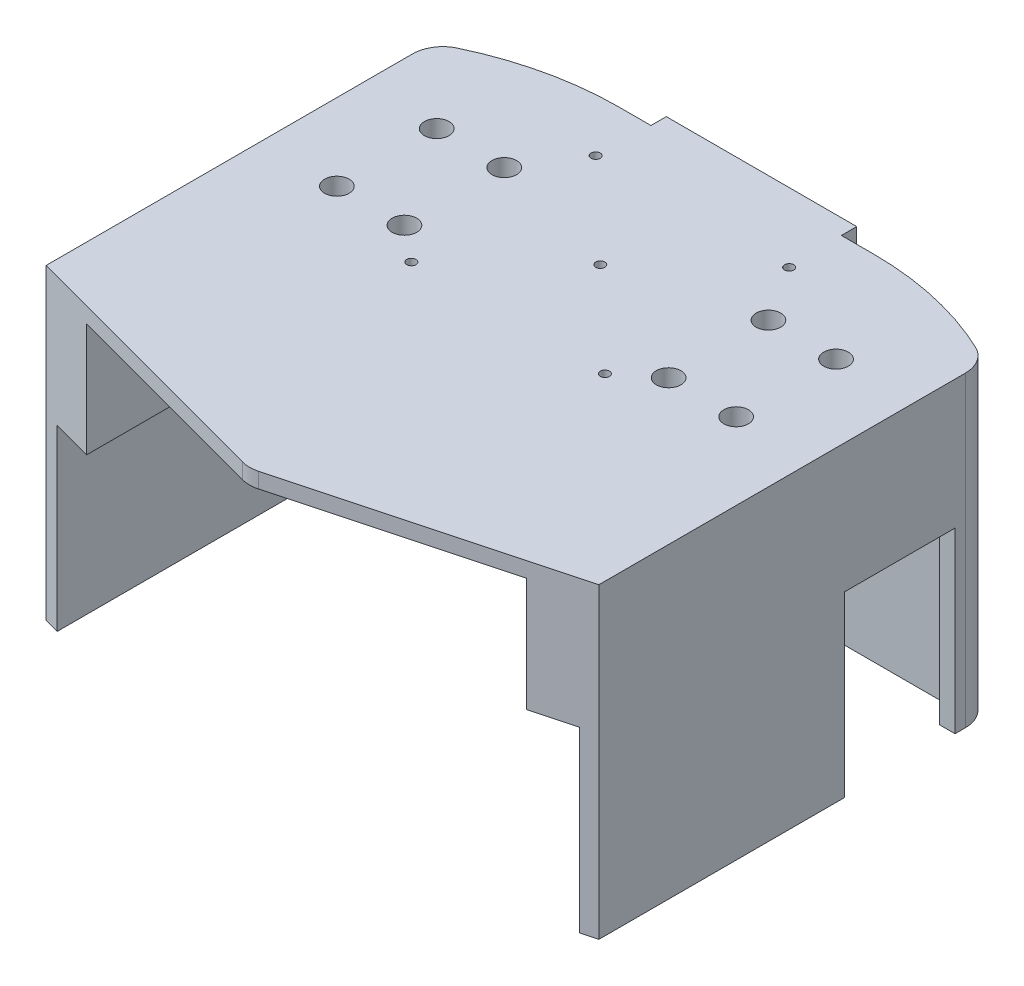
from build123d import *

# Parameters (mm, degrees)
BOSS_EXTRUDE1_DEPTH      = 50
BOSS_EXTRUDE1_DEPTH_BACK = 50
SKETCH1_W                = 180
SKETCH1_H                = 152.061
SHELL1_T                 = -5
SKETCH3_W                = 170
SKETCH3_H                = 142.061
BOSS_EXTRUDE2_DEPTH      = 37
CUT_EXTRUDE1_REACH       = 203.694
SKETCH2_W                = 36
SKETCH2_H                = 58
SKETCH4_W                = 36
SKETCH4_H                = 46.5
SKETCH4_R                = 1.5
CUT_EXTRUDE2_DEPTH       = 2
SKETCH4_3_R              = 1.5
CUT_EXTRUDE3_DEPTH       = 132.318836921
SKETCH5_W                = 159.952904784
SKETCH5_H                = 5
CUT_EXTRUDE4_DEPTH       = 63
SKETCH8_W                = 72
SKETCH8_H                = 29.937457508
CUT_EXTRUDE5_DEPTH       = 37
SKETCH9_R                = 1.5
CUT_EXTRUDE6_DEPTH       = 10
CUT_EXTRUDE7_DEPTH       = 102
FILLET1_R                = 10
SKETCH11_W               = 62
SKETCH11_H               = 5
BOSS_EXTRUDE3_DEPTH      = 100
SKETCH12_W               = 57
SKETCH12_H               = 3
SKETCH12_W_2             = 43
SKETCH12_H_2             = 2
CUT_EXTRUDE8_DEPTH       = 91
SKETCH13_W               = 57
SKETCH13_H               = 3
CUT_EXTRUDE9_DEPTH       = 7
FILLET2_R                = 10
FILLET3_R                = 100
SKETCH15_R               = 4
CUT_EXTRUDE10_DEPTH      = 28


with BuildPart() as part:
    # Sketch1 → Boss-Extrude1 (new, two sides: drawn at the far end of the back side and taken through both)
    with BuildSketch(Plane(origin=(0, 0, 0), x_dir=(1, 0, 0), z_dir=(0, 1, 0)).offset(-BOSS_EXTRUDE1_DEPTH_BACK)):
        Rectangle(SKETCH1_W, SKETCH1_H)
    extrude(amount=BOSS_EXTRUDE1_DEPTH + BOSS_EXTRUDE1_DEPTH_BACK)

    # Shell1
    shell1_openings = [part.faces().sort_by_distance(p)[0] for p in [
        (0, -50, 0),
    ]]
    offset(amount=SHELL1_T, openings=shell1_openings, kind=Kind.INTERSECTION)

    # Sketch3 → Boss-Extrude2 (add)
    with BuildSketch(Plane.XZ.offset(-45)):
        Rectangle(SKETCH3_W, SKETCH3_H)
    extrude(amount=BOSS_EXTRUDE2_DEPTH)

    # Sketch2 → Cut-Extrude1 (cut, up to next)
    with BuildSketch(Plane.ZY.offset(90), mode=Mode.PRIVATE) as cut_extrude1_sk1:
        with Locations((-46.0305, -21)):
            Rectangle(SKETCH2_W, SKETCH2_H)
    cut_extrude1_tool1 = extrude(cut_extrude1_sk1.sketch, amount=-CUT_EXTRUDE1_REACH, mode=Mode.PRIVATE) & part.part
    cut_extrude1 = cut_extrude1_tool1.solids().sort_by_distance((-90, -21, -46.0305))[0]
    add(cut_extrude1, mode=Mode.SUBTRACT)

    # Mirror1: Cut-Extrude1 across plane
    add(cut_extrude1.mirror(Plane(origin=(0, 0, 0), x_dir=(0, 0, 1), z_dir=(1, 0, 0))), mode=Mode.SUBTRACT)

    # Sketch4 → Cut-Extrude2 (cut)
    with BuildSketch(Plane.XZ.offset(-8)):
        with Locations((-54, -34.0305)):
            Rectangle(SKETCH4_W, SKETCH4_H)
        with Locations(Location((-43, -50.2805, 0), (0, 0, 270))):
            Circle(SKETCH4_R, mode=Mode.SUBTRACT)
        with Locations(Location((-65, -50.2805, 0), (0, 0, 270))):
            Circle(SKETCH4_R, mode=Mode.SUBTRACT)
        with Locations(Location((-43, -17.7805, 0), (0, 0, 270))):
            Circle(SKETCH4_R, mode=Mode.SUBTRACT)
        with Locations(Location((-65, -17.7805, 0), (0, 0, 270))):
            Circle(SKETCH4_R, mode=Mode.SUBTRACT)
    cut_extrude2 = extrude(amount=-CUT_EXTRUDE2_DEPTH, mode=Mode.SUBTRACT)

    # Sketch4<3> → Cut-Extrude3 (cut, through all)
    with BuildSketch(Plane.XZ.offset(-8)):
        with BuildLine():
            Line((-65, -19.2805), (-65, -17.7805))
            Line((-65, -17.7805), (-63.5, -17.7805))
            ThreePointArc((-63.5, -17.7805), (-66.060660172, -16.719839828), (-65, -19.2805))
        make_face()
        with BuildLine():
            Line((-63.5, -17.7805), (-65, -17.7805))
            Line((-65, -17.7805), (-65, -19.2805))
            ThreePointArc((-65, -19.2805), (-63.939339828, -18.841160172), (-63.5, -17.7805))
        make_face()
        with BuildLine():
            Line((-65, -19.2805), (-65, -17.7805))
            Line((-65, -17.7805), (-63.5, -17.7805))
            ThreePointArc((-63.5, -17.7805), (-66.060660172, -16.719839828), (-65, -19.2805))
        make_face()
        with BuildLine():
            Line((-63.5, -17.7805), (-65, -17.7805))
            Line((-65, -17.7805), (-65, -19.2805))
            ThreePointArc((-65, -19.2805), (-63.939339828, -18.841160172), (-63.5, -17.7805))
        make_face()
        with Locations(Location((-43, -17.7805, 0), (0, 0, 270))):
            Circle(SKETCH4_3_R)
        with Locations(Location((-65, -50.2805, 0), (0, 0, 270))):
            Circle(SKETCH4_3_R)
        with Locations(Location((-43, -50.2805, 0), (0, 0, 270))):
            Circle(SKETCH4_3_R)
    cut_extrude3 = extrude(amount=-CUT_EXTRUDE3_DEPTH, mode=Mode.SUBTRACT)

    # Mirror2: Cut-Extrude2, Cut-Extrude3 across plane
    add(cut_extrude2.mirror(Plane(origin=(0, 0, 0), x_dir=(0, 0, 1), z_dir=(1, 0, 0))), mode=Mode.SUBTRACT)
    add(cut_extrude3.mirror(Plane(origin=(0, 0, 0), x_dir=(0, 0, 1), z_dir=(1, 0, 0))), mode=Mode.SUBTRACT)

    # Sketch5 → Cut-Extrude4 (cut)
    with BuildSketch(Plane.XZ.offset(-8)):
        with Locations((5.023547608, 73.5305)):
            Rectangle(SKETCH5_W, SKETCH5_H)
    extrude(amount=CUT_EXTRUDE4_DEPTH, mode=Mode.SUBTRACT)

    # Sketch8 → Cut-Extrude5 (cut)
    with BuildSketch(Plane.XZ.offset(-8)):
        Polygon((-36, -71.0305), (36, -71.0305), (36, -57.2805), (36, -10.7805), (-36, -10.7805), (-36, -57.2805), align=None)
        with Locations((0, 4.188228754)):
            Rectangle(SKETCH8_W, SKETCH8_H)
        Polygon((36, 19.156957508), (36, -10.7805), (71.419165144, -10.7805), (71.419165144, 76.0305), (-72, 76.0305), (-72, -10.7805), (-36, -10.7805), (-36, 19.156957508), align=None)
    extrude(amount=-CUT_EXTRUDE5_DEPTH, mode=Mode.SUBTRACT)

    # Sketch9 → Cut-Extrude6 (cut)
    with BuildSketch(Plane.XZ.offset(-45)):
        with Locations(Location((31.5, -68.5305, 0), (0, 0, 270))):
            Circle(SKETCH9_R)
        with Locations(Location((-31.5, -68.5305, 0), (0, 0, 270))):
            Circle(SKETCH9_R)
        with Locations(Location((31.5, -8.5305, 0), (0, 0, 270))):
            Circle(SKETCH9_R)
        with Locations(Location((-31.5, -8.5305, 0), (0, 0, 270))):
            Circle(SKETCH9_R)
        with Locations(Location((0, -38.5305, 0), (0, 0, 270))):
            Circle(SKETCH9_R)
    extrude(amount=-CUT_EXTRUDE6_DEPTH, mode=Mode.SUBTRACT)

    # Sketch10 → Cut-Extrude7 (cut)
    with BuildSketch(Plane.XZ.offset(50)):
        Polygon((0, 76.0305), (90, 51.915072681), (90, 76.0305), align=None)
    cut_extrude7 = extrude(amount=-CUT_EXTRUDE7_DEPTH, mode=Mode.SUBTRACT)

    # Mirror3: Cut-Extrude7 across plane
    add(cut_extrude7.mirror(Plane(origin=(0, 0, 0), x_dir=(0, 0, 1), z_dir=(1, 0, 0))), mode=Mode.SUBTRACT)

    # Fillet1
    fillet1_edges = [part.edges().sort_by_distance(p)[0] for p in [
        (0, 47.5, 76.0305),
    ]]
    fillet(fillet1_edges, radius=FILLET1_R)

    # Sketch11 → Boss-Extrude3 (add)
    with BuildSketch(Plane.XZ.offset(50)):
        Polygon((85, -86.0305), (85, -76.0305), (-85, -76.0305), (-85, -86.0305), (-31, -86.0305), (31, -86.0305), align=None)
        with Locations((0, -88.5305)):
            Rectangle(SKETCH11_W, SKETCH11_H)
    extrude(amount=-BOSS_EXTRUDE3_DEPTH)

    # Sketch12 → Cut-Extrude8 (cut)
    with BuildSketch(Plane.XZ.offset(50)):
        with Locations((0, -87.5305)):
            Rectangle(SKETCH12_W, SKETCH12_H)
        with Locations((0, -90.0305)):
            Rectangle(SKETCH12_W_2, SKETCH12_H_2)
    extrude(amount=-CUT_EXTRUDE8_DEPTH, mode=Mode.SUBTRACT)

    # Sketch13 → Cut-Extrude9 (cut)
    with BuildSketch(Plane.XZ.offset(-41)):
        with Locations((0, -87.5305)):
            Rectangle(SKETCH13_W, SKETCH13_H)
    extrude(amount=-CUT_EXTRUDE9_DEPTH, mode=Mode.SUBTRACT)

    # Fillet2
    # the kernel refuses this fillet: 10 mm, written as the material it takes off along each edge
    with BuildSketch(Plane(origin=(90, -71.650635095, -76.0305), x_dir=(0, 0, 1), z_dir=(0, 1, 0))) as fillet2_piece_1:
        with BuildLine():
            CenterArc((8.660254038, -10), FILLET2_R, 90, 60)
            Line((0, -5), (-0.173205081, -4.9))
            ThreePointArc((-0.173205081, -4.9), (-0.2, -2.5), (-0.2, 0))
            Line((-0.2, 0), (0, 0.2))
            Line((0, 0.2), (8.660254038, 0.2))
            Line((8.660254038, 0.2), (8.660254038, 0))
        make_face()
    extrude(amount=143.301270189, mode=Mode.SUBTRACT)
    with BuildSketch(Plane(origin=(-90, 71.650635095, -76.0305), x_dir=(1, 0, 0), z_dir=(0, -1, 0))) as fillet2_piece_2:
        with BuildLine():
            CenterArc((10, 8.660254038), FILLET2_R, 180, 60)
            Line((0, 8.660254038), (-0.2, 8.660254038))
            Line((-0.2, 8.660254038), (-0.2, 0))
            Line((-0.2, 0), (0, -0.2))
            ThreePointArc((0, -0.2), (2.5, -0.2), (4.9, -0.173205081))
            Line((4.9, -0.173205081), (5, 0))
        make_face()
    extrude(amount=143.301270189, mode=Mode.SUBTRACT)

    # Fillet3
    # the kernel refuses this fillet: 100 mm, written as the material it takes off along each edge
    with BuildSketch(Plane(origin=(-85, -158.972473589, -86.0305), x_dir=(1, 0, 0), z_dir=(0, 1, 0))) as fillet3_piece_1:
        with BuildLine():
            CenterArc((43.588989435, -100), FILLET3_R, 90, 25.841932763)
            Line((0, -10), (0, 0))
            Line((0, 0), (43.588989435, 0))
        make_face()
    extrude(amount=317.944947177, mode=Mode.SUBTRACT)
    with BuildSketch(Plane(origin=(85, -158.972473589, -86.0305), x_dir=(0, 0, 1), z_dir=(0, 1, 0))) as fillet3_piece_2:
        with BuildLine():
            CenterArc((100, -43.588989435), FILLET3_R, 154.158067237, 25.841932763)
            Line((0, -43.588989435), (0, 0))
            Line((0, 0), (10, 0))
        make_face()
    extrude(amount=317.944947177, mode=Mode.SUBTRACT)

    # Sketch15 → Cut-Extrude10 (cut)
    with BuildSketch(Plane(origin=(0, 50, 0), x_dir=(1, 0, 0), z_dir=(0, 1, 0))):
        with Locations(Location((65, 17.7805, 0), (0, 0, 270))):
            Circle(SKETCH15_R)
        with Locations(Location((43, 17.7805, 0), (0, 0, 270))):
            Circle(SKETCH15_R)
        with Locations(Location((65, 50.2805, 0), (0, 0, 270))):
            Circle(SKETCH15_R)
        with Locations(Location((-43, 50.2805, 0), (0, 0, 90))):
            Circle(SKETCH15_R)
        with Locations(Location((43, 50.2805, 0), (0, 0, 270))):
            Circle(SKETCH15_R)
        with Locations(Location((-65, 50.2805, 0), (0, 0, 90))):
            Circle(SKETCH15_R)
        with Locations(Location((-43, 17.7805, 0), (0, 0, 90))):
            Circle(SKETCH15_R)
        with Locations(Location((-65, 17.7805, 0), (0, 0, 90))):
            Circle(SKETCH15_R)
    extrude(amount=-CUT_EXTRUDE10_DEPTH, mode=Mode.SUBTRACT)


solid = part.part
